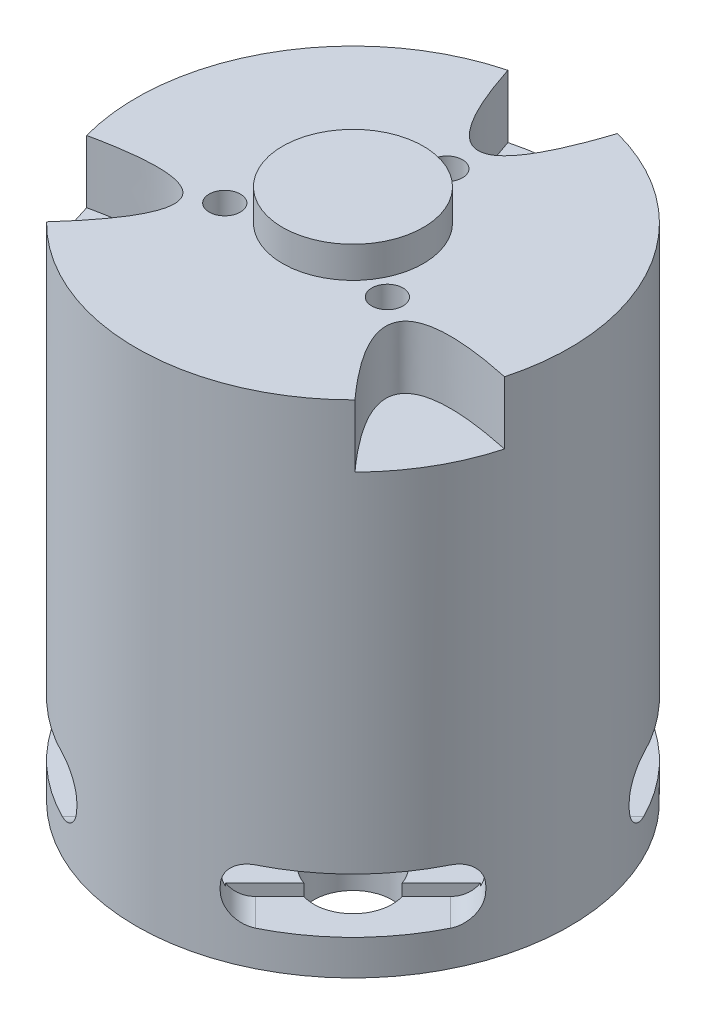
from build123d import *

# Parameters (mm, degrees)
SKETCH1_R           = 13.85
SKETCH1_R_2         = 1.5
SKETCH1_R_3         = 2.5
BOSS_EXTRUDE1_DEPTH = 3
SKETCH2_R           = 13.85
SKETCH2_R_2         = 12.35
BOSS_EXTRUDE2_DEPTH = 4
CUT_EXTRUDE1_DEPTH  = 3.2
CIRPATTERN1_COUNT   = 4
SKETCH4_R           = 13.85
BOSS_EXTRUDE3_DEPTH = 25
CUT_EXTRUDE2_START  = -4
SKETCH5_R           = 1
CUT_EXTRUDE2_DEPTH  = 4
SKETCH6_R           = 4.5
BOSS_EXTRUDE4_DEPTH = 2
SKETCH7_R           = 1.585
BOSS_EXTRUDE5_DEPTH = 3


with BuildPart() as part:
    # Sketch1 → Boss-Extrude1 (new body)
    with BuildSketch(Plane(origin=(0, 0, 0), x_dir=(1, 0, 0), z_dir=(0, 1, 0))):
        Circle(SKETCH1_R)
        with Locations((0, 8)):
            Circle(SKETCH1_R_2, mode=Mode.SUBTRACT)
        with Locations((-9.5, 0)):
            Circle(SKETCH1_R_2, mode=Mode.SUBTRACT)
        with Locations((-6.717514421, 6.717514421)):
            Circle(SKETCH1_R_3, mode=Mode.SUBTRACT)
        with Locations((6.717514421, 6.717514421)):
            Circle(SKETCH1_R_3, mode=Mode.SUBTRACT)
        with Locations((9.5, 0)):
            Circle(SKETCH1_R_2, mode=Mode.SUBTRACT)
        with Locations((6.717514421, -6.717514421)):
            Circle(SKETCH1_R_3, mode=Mode.SUBTRACT)
        with Locations((0, -8)):
            Circle(SKETCH1_R_2, mode=Mode.SUBTRACT)
        with Locations((-6.717514421, -6.717514421)):
            Circle(SKETCH1_R_3, mode=Mode.SUBTRACT)
    extrude(amount=BOSS_EXTRUDE1_DEPTH)

    # Sketch2 → Boss-Extrude2 (add)
    with BuildSketch(Plane(origin=(0, 3, 0), x_dir=(1, 0, 0), z_dir=(0, 1, 0))):
        Circle(SKETCH2_R)
        Circle(SKETCH2_R_2, mode=Mode.SUBTRACT)
    extrude(amount=BOSS_EXTRUDE2_DEPTH)

    # Sketch3 → Cut-Extrude1 (cut)
    with BuildSketch(Plane(origin=(-9.793428919, 0, 9.793428919), x_dir=(0, -1, 0), z_dir=(-0.7071067811865488, 0, 0.7071067811865464))):
        with BuildLine():
            Line((-4.15, 6), (-3.85, 6))
            ThreePointArc((-3.85, 6), (-2.71862915, 5.53137085), (-2.25, 4.4))
            Line((-2.25, 4.4), (-2.25, -4.4))
            ThreePointArc((-2.25, -4.4), (-2.71862915, -5.53137085), (-3.85, -6))
            Line((-3.85, -6), (-4.15, -6))
            ThreePointArc((-4.15, -6), (-5.28137085, -5.53137085), (-5.75, -4.4))
            Line((-5.75, -4.4), (-5.75, 4.4))
            ThreePointArc((-5.75, 4.4), (-5.28137085, 5.53137085), (-4.15, 6))
        make_face()
    cut_extrude1 = extrude(amount=-CUT_EXTRUDE1_DEPTH, mode=Mode.SUBTRACT)

    # CirPattern1: Cut-Extrude1 ×4 about axis
    cirpattern1_axis = Axis((0, 7, 0), (0, -1, 0))
    for i in range(1, CIRPATTERN1_COUNT):
        add(cut_extrude1.rotate(cirpattern1_axis, i * 360 / CIRPATTERN1_COUNT), mode=Mode.SUBTRACT)

    # Sketch4 → Boss-Extrude3 (add)
    with BuildSketch(Plane(origin=(0, 7, 0), x_dir=(1, 0, 0), z_dir=(0, 1, 0))):
        Circle(SKETCH4_R)
    extrude(amount=BOSS_EXTRUDE3_DEPTH)

    # Sketch5 → Cut-Extrude2 (cut)
    with BuildSketch(Plane(origin=(0, 32, 0), x_dir=(1, 0, 0), z_dir=(0, 1, 0)).offset(CUT_EXTRUDE2_START)):
        with Locations((0, 6)):
            Circle(SKETCH5_R)
        with Locations((5.196152423, -3)):
            Circle(SKETCH5_R)
        with Locations((-5.196152423, -3)):
            Circle(SKETCH5_R)
        with BuildLine():
            ThreePointArc((-13.355144333, -3.669144292), (-11.994451842, -6.925), (-9.855144333, -9.731322118))
            add(Edge.make_bspline(
                [(-9.855144333, -9.731322118), (-2.251262127, -1.299766795), (-13.355144333, -3.669144292)],
                knots=[0, 0, 0, 1, 1, 1], degree=2))
        make_face()
        with BuildLine():
            ThreePointArc((3.5, 13.40046641), (0, 13.85), (-3.5, 13.40046641))
            add(Edge.make_bspline(
                [(-3.5, 13.40046641), (0, 2.59953359), (3.5, 13.40046641)],
                knots=[0, 0, 0, 1, 1, 1], degree=2))
        make_face()
        with BuildLine():
            ThreePointArc((9.855144333, -9.731322118), (11.994451842, -6.925), (13.355144333, -3.669144292))
            add(Edge.make_bspline(
                [(13.355144333, -3.669144292), (2.251262127, -1.299766795), (9.855144333, -9.731322118)],
                knots=[0, 0, 0, 1, 1, 1], degree=2))
        make_face()
    extrude(amount=CUT_EXTRUDE2_DEPTH, mode=Mode.SUBTRACT)

    # Sketch6 → Boss-Extrude4 (add)
    with BuildSketch(Plane(origin=(0, 32, 0), x_dir=(1, 0, 0), z_dir=(0, 1, 0))):
        Circle(SKETCH6_R)
    extrude(amount=BOSS_EXTRUDE4_DEPTH)

    # Sketch7 → Boss-Extrude5 (add)
    with BuildSketch(Plane.XZ):
        Circle(SKETCH7_R)
    extrude(amount=BOSS_EXTRUDE5_DEPTH)


solid = part.part
